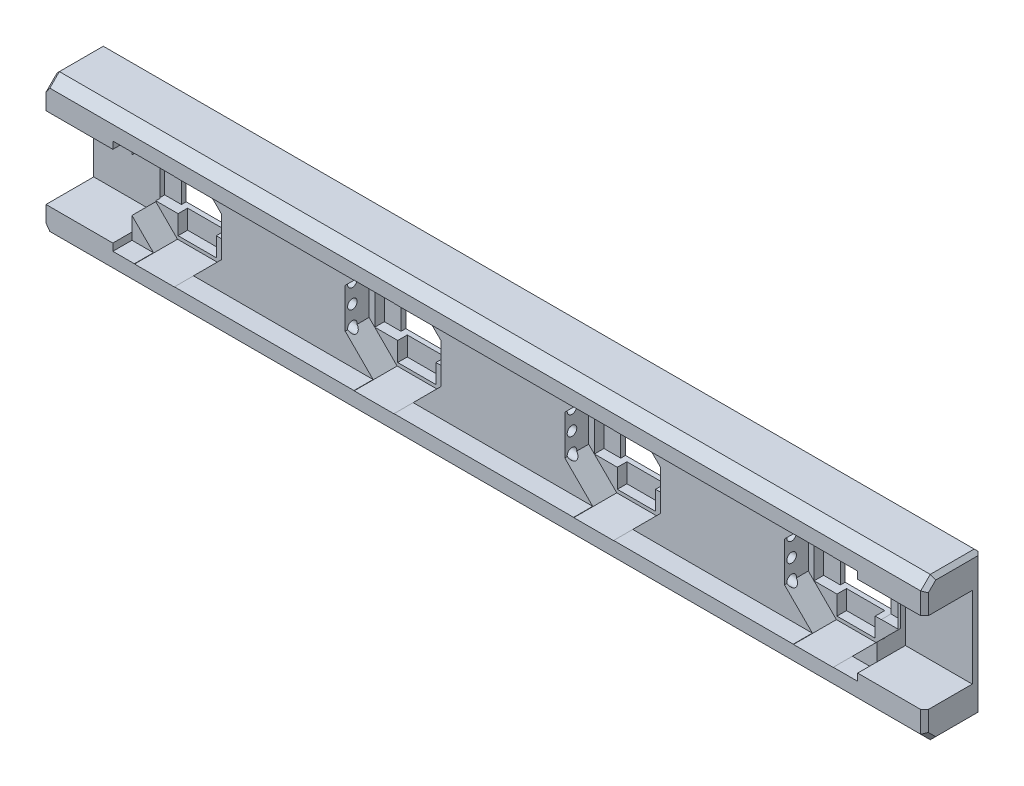
from build123d import *

# Parameters (mm, degrees)
SKETCH1_W                = 92
SKETCH1_H                = 15
BOSS_EXTRUDE1_DEPTH      = 6
CUT_EXTRUDE8_DEPTH       = 92
SKETCH13_W               = 0.5
SKETCH13_H               = 10
CUT_EXTRUDE9_DEPTH       = 0.6
FILLET1_R                = 0.25
FILLET2_R                = 0.25
CHAMFER1_SIZE            = 0.4
CHAMFER2_SIZE            = 0.4
CHAMFER3_SIZE            = 0.4
CHAMFER4_SIZE            = 0.4
CHAMFER5_SIZE            = 0.4
CUT_EXTRUDE10_DEPTH      = 4.5
SKETCH16_W               = 5.3
SKETCH16_H               = 5.3
CUT_EXTRUDE11_DEPTH      = 4.5
SKETCH17_W               = 4
SKETCH17_H               = 2
CUT_EXTRUDE12_DEPTH      = 1
SKETCH18_W               = 1.75
SKETCH18_H               = 5.318073247
SKETCH18_H_2             = 5.281926753
CUT_EXTRUDE13_DEPTH      = 1
LPATTERN1_COUNT          = 4
LPATTERN1_PITCH          = 23
SKETCH19_W               = 7
SKETCH19_H               = 8.5
CUT_EXTRUDE14_DEPTH      = 5
SKETCH20_W               = 78
SKETCH20_H               = 10
CUT_EXTRUDE15_DEPTH      = 2
CUT_EXTRUDE16_DEPTH      = 80.806458515
CUT_EXTRUDE16_DEPTH_BACK = 80.806458515
SKETCH21_R               = 0.5


with BuildPart() as part:
    # Sketch1 → Boss-Extrude1 (new body)
    with BuildSketch(Plane.XY):
        with Locations((0.25, 18.154296875)):
            Rectangle(SKETCH1_W, SKETCH1_H)
    extrude(amount=BOSS_EXTRUDE1_DEPTH)

    # Sketch12 → Cut-Extrude8 (cut)
    with BuildSketch(Plane(origin=(46.25, 0, 0), x_dir=(0, 0, -1), z_dir=(1, 0, 0))):
        Polygon((-6, 25.654296875), (-6, 24.654296875), (-5, 25.654296875), align=None)
        Polygon((-6, 10.654296875), (-5, 10.654296875), (-6, 11.654296875), align=None)
    extrude(amount=-CUT_EXTRUDE8_DEPTH, mode=Mode.SUBTRACT)

    # Sketch13 → Cut-Extrude9 (cut)
    with BuildSketch(Plane(origin=(0, 0, 0), x_dir=(-1, 0, 0), z_dir=(0, 0, -1))):
        with Locations((43.5, 18.154296875)):
            Rectangle(SKETCH13_W, SKETCH13_H)
    extrude(amount=-CUT_EXTRUDE9_DEPTH, mode=Mode.SUBTRACT)

    # Fillet1
    fillet1_edges = [part.edges().sort_by_distance(p)[0] for p in [
        (-43.75, 18.154296875, 0),
    ]]
    fillet(fillet1_edges, radius=FILLET1_R)

    # Fillet2
    fillet2_edges = [part.edges().sort_by_distance(p)[0] for p in [
        (-43.25, 18.154296875, 0.6),
        (-43.5, 23.154296875, 0.6),
        (-43.75, 18.154296875, 0.6),
        (-43.5, 13.154296875, 0.6),
    ]]
    fillet(fillet2_edges, radius=FILLET2_R - 0.0001)  # a hair under: the kernel refuses the full size

    # Chamfer1
    chamfer1_edges = [part.edges().sort_by_distance(p)[0] for p in [
        (0.25, 25.654296875, 0),
        (0.25, 10.654296875, 0),
    ]]
    chamfer(chamfer1_edges, length=CHAMFER1_SIZE)

    # Chamfer2
    chamfer2_edges = [part.edges().sort_by_distance(p)[0] for p in [
        (46.25, 18.154296875, 0),
        (-45.75, 18.154296875, 0),
    ]]
    chamfer(chamfer2_edges, length=CHAMFER2_SIZE)

    # Chamfer3
    chamfer3_edges = [part.edges().sort_by_distance(p)[0] for p in [
        (-45.75, 25.654296875, 2.7),
        (-45.75, 10.654296875, 2.7),
    ]]
    chamfer(chamfer3_edges, length=CHAMFER3_SIZE)

    # Chamfer4
    chamfer4_edges = [part.edges().sort_by_distance(p)[0] for p in [
        (-45.75, 11.354296875, 5.7),
        (-45.75, 24.954296875, 5.7),
    ]]
    chamfer(chamfer4_edges, length=CHAMFER4_SIZE)

    # Chamfer5
    chamfer5_edges = [part.edges().sort_by_distance(p)[0] for p in [
        (46.25, 18.154296875, 6),
        (46.25, 25.654296875, 2.7),
        (46.25, 10.654296875, 2.7),
        (46.25, 25.154296875, 5.5),
        (46.25, 11.154296875, 5.5),
    ]]
    chamfer(chamfer5_edges, length=CHAMFER5_SIZE)

    # Sketch15 → Cut-Extrude10 (cut)
    with BuildSketch(Plane.XY.offset(6)):
        Polygon((-29.382117138, 20.232772011), (-32.321524864, 23.172179737), (-36.478475136, 23.172179737), (-39.417882862, 20.232772011), (-39.417882862, 16.075821739), (-36.478475136, 13.136414013), (-32.321524864, 13.136414013), (-29.382117138, 16.075821739), align=None)
    cut_extrude10 = extrude(amount=-CUT_EXTRUDE10_DEPTH, mode=Mode.SUBTRACT)

    # Sketch16 → Cut-Extrude11 (cut)
    with BuildSketch(Plane.XY.offset(1.5)):
        with Locations((-34.417882862, 18.136414013)):
            Rectangle(SKETCH16_W, SKETCH16_H)
    cut_extrude11 = extrude(amount=-CUT_EXTRUDE11_DEPTH, mode=Mode.SUBTRACT)

    # Sketch17 → Cut-Extrude12 (cut)
    with BuildSketch(Plane.XY.offset(1.5)):
        with Locations((-34.417882862, 14.486414013)):
            Rectangle(SKETCH17_W, SKETCH17_H)
        with Locations((-34.417882862, 21.786414013)):
            Rectangle(SKETCH17_W, SKETCH17_H)
    cut_extrude12 = extrude(amount=-CUT_EXTRUDE12_DEPTH, mode=Mode.SUBTRACT)

    # Sketch18 → Cut-Extrude13 (cut)
    with BuildSketch(Plane.XY.offset(1.5)):
        with Locations((-37.942882862, 18.145450637)):
            Rectangle(SKETCH18_W, SKETCH18_H)
        with Locations((-30.892882862, 18.145450637)):
            Rectangle(SKETCH18_W, SKETCH18_H_2)
    cut_extrude13 = extrude(amount=-CUT_EXTRUDE13_DEPTH, mode=Mode.SUBTRACT)

    # LPattern1: Cut-Extrude10, Cut-Extrude11, Cut-Extrude12, Cut-Extrude13 ×4
    with Locations(*[(i * LPATTERN1_PITCH, 0, 0) for i in range(1, LPATTERN1_COUNT)]):
        add(cut_extrude10, mode=Mode.SUBTRACT)
        add(cut_extrude11, mode=Mode.SUBTRACT)
        add(cut_extrude12, mode=Mode.SUBTRACT)
        add(cut_extrude13, mode=Mode.SUBTRACT)

    # Sketch19 → Cut-Extrude14 (cut)
    with BuildSketch(Plane.XY.offset(6)):
        with Locations((-42.25, 18.154296875)):
            Rectangle(SKETCH19_W, SKETCH19_H)
        with Locations((42.75, 18.154296875)):
            Rectangle(SKETCH19_W, SKETCH19_H)
    extrude(amount=-CUT_EXTRUDE14_DEPTH, mode=Mode.SUBTRACT)

    # Sketch20 → Cut-Extrude15 (cut)
    with BuildSketch(Plane.XY.offset(6)):
        with Locations((0.25, 18.154296875)):
            Rectangle(SKETCH20_W, SKETCH20_H)
    extrude(amount=-CUT_EXTRUDE15_DEPTH, mode=Mode.SUBTRACT)

    # Sketch21 → Cut-Extrude16 (cut, two sides: drawn at the far end of the back side and taken through both)
    with BuildSketch(Plane(origin=(29.582117138, 0, 0), x_dir=(0, 0, -1), z_dir=(1, 0, 0)).offset(-CUT_EXTRUDE16_DEPTH_BACK)):
        with Locations(Location((-3.25, 18.162772011, 0), (0, 0, 180))):
            Circle(SKETCH21_R)
        with Locations(Location((-3.25, 20.162772011, 0), (0, 0, 171.952153753))):
            Circle(SKETCH21_R)
        with Locations(Location((-3.25, 16.162772011, 0), (0, 0, 190.014682892))):
            Circle(SKETCH21_R)
    extrude(amount=CUT_EXTRUDE16_DEPTH + CUT_EXTRUDE16_DEPTH_BACK, mode=Mode.SUBTRACT)


solid = part.part
